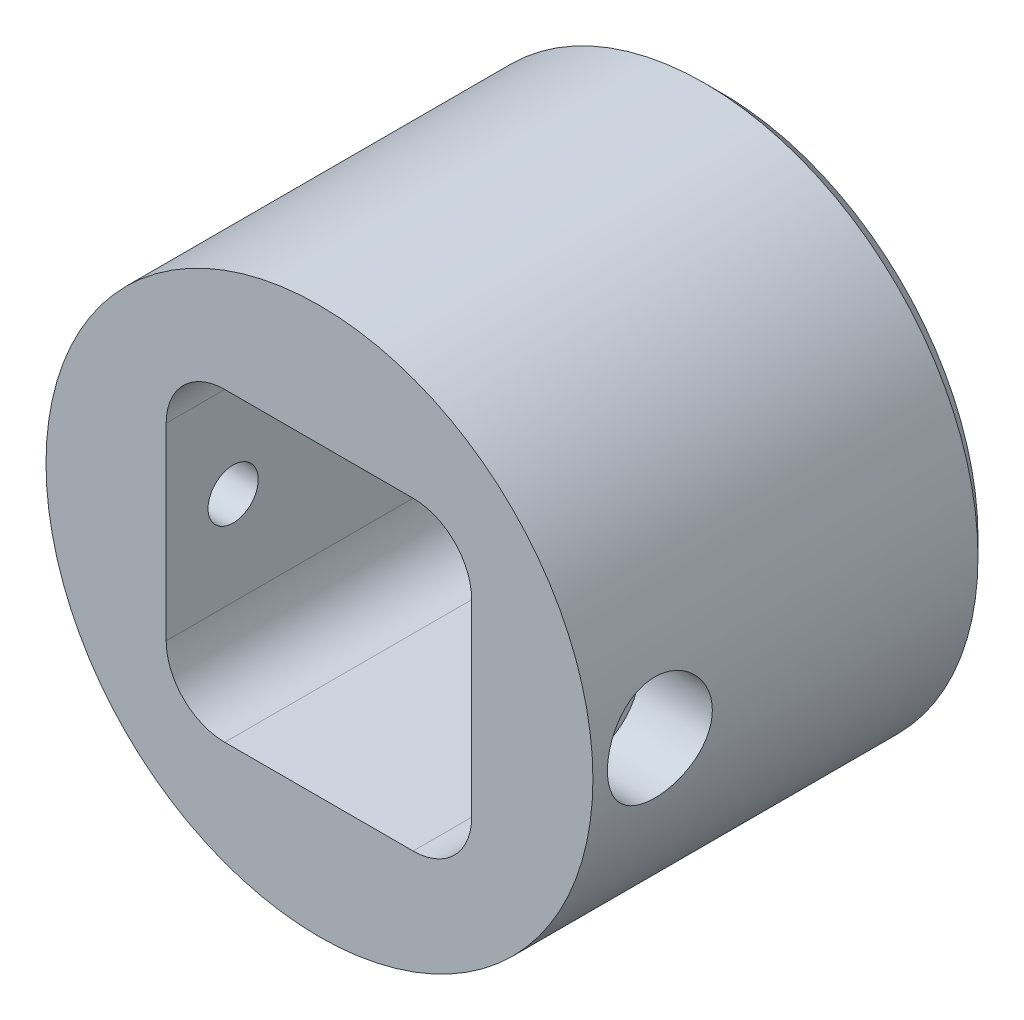
from build123d import *

# Parameters (mm, degrees)
SKETCH1_R               = 12.25
SKETCH1_R_2             = 1.75
BOSS_EXTRUDE1_DEPTH     = 18
CUT_EXTRUDE2_DEPTH      = 25.982493871
CUT_EXTRUDE2_DEPTH_BACK = 25.982493871
SKETCH3_R               = 1.125
CUT_EXTRUDE3_START      = -9
SKETCH4_R               = 2.35
CUT_EXTRUDE3_DEPTH      = 5
CUT_EXTRUDE4_START      = 14
SKETCH4_2_R             = 2.35
CUT_EXTRUDE4_DEPTH      = 5
CUT_EXTRUDE5_DEPTH      = 16
CHAMFER1_SIZE           = 0.75
CHAMFER2_SIZE           = 0.5


with BuildPart() as part:
    # Sketch1 → Boss-Extrude1 (new body)
    with BuildSketch(Plane.XY):
        Circle(SKETCH1_R)
        with Locations((-4.242640687, 4.242640687)):
            Circle(SKETCH1_R_2, mode=Mode.SUBTRACT)
        with Locations((4.242640687, 4.242640687)):
            Circle(SKETCH1_R_2, mode=Mode.SUBTRACT)
        with Locations((4.242640687, -4.242640687)):
            Circle(SKETCH1_R_2, mode=Mode.SUBTRACT)
        with Locations((-4.242640687, -4.242640687)):
            Circle(SKETCH1_R_2, mode=Mode.SUBTRACT)
    extrude(amount=BOSS_EXTRUDE1_DEPTH)

    # Sketch3 → Cut-Extrude2 (cut, two sides: drawn at the far end of the back side and taken through both)
    with BuildSketch(Plane(origin=(0, 0, 0), x_dir=(0, 0, -1), z_dir=(1, 0, 0)).offset(-CUT_EXTRUDE2_DEPTH_BACK)):
        with Locations((-15, 0)):
            Circle(SKETCH3_R)
    extrude(amount=CUT_EXTRUDE2_DEPTH + CUT_EXTRUDE2_DEPTH_BACK, mode=Mode.SUBTRACT)

    # Sketch4 → Cut-Extrude3 (cut)
    with BuildSketch(Plane(origin=(0, 0, 0), x_dir=(0, 0, -1), z_dir=(1, 0, 0)).offset(CUT_EXTRUDE3_START)):
        with Locations((-15, 0)):
            Circle(SKETCH4_R)
    extrude(amount=-CUT_EXTRUDE3_DEPTH, mode=Mode.SUBTRACT)

    # Sketch4<2> → Cut-Extrude4 (cut)
    with BuildSketch(Plane(origin=(0, 0, 0), x_dir=(0, 0, -1), z_dir=(1, 0, 0)).offset(CUT_EXTRUDE4_START)):
        with Locations((-15, 0)):
            Circle(SKETCH4_2_R)
    extrude(amount=-CUT_EXTRUDE4_DEPTH, mode=Mode.SUBTRACT)

    # Sketch2 → Cut-Extrude5 (cut)
    with BuildSketch(Plane.XY.offset(18)):
        with BuildLine():
            Line((4.19425359, 6.867640687), (-4.242640687, 6.867640687))
            ThreePointArc((-4.242640687, 6.867640687), (-6.098795988, 6.098795988), (-6.867640687, 4.242640687))
            Line((-6.867640687, 4.242640687), (-6.867640687, -4.19425359))
            ThreePointArc((-6.867640687, -4.19425359), (-6.098795988, -6.050408891), (-4.242640687, -6.81925359))
            Line((-4.242640687, -6.81925359), (4.194253555, -6.81925359))
            ThreePointArc((4.194253555, -6.81925359), (6.050408878, -6.050408904), (6.81925359, -4.19425359))
            Line((6.81925359, -4.19425359), (6.81925359, 4.242640687))
            ThreePointArc((6.81925359, 4.242640687), (6.050408891, 6.098795988), (4.19425359, 6.867640687))
        make_face()
    extrude(amount=-CUT_EXTRUDE5_DEPTH, mode=Mode.SUBTRACT)

    # Chamfer1
    chamfer1_edges = [part.edges().sort_by_distance(p)[0] for p in [
        (-12.25, 0, 0),
    ]]
    chamfer(chamfer1_edges, length=CHAMFER1_SIZE)

    # Chamfer2
    chamfer2_edges = [part.edges().sort_by_distance(p)[0] for p in [
        (2.492640687, -4.242640687, 0),
        (-5.992640687, -4.242640687, 0),
        (-5.992640687, 4.242640687, 0),
        (2.492640687, 4.242640687, 0),
    ]]
    chamfer(chamfer2_edges, length=CHAMFER2_SIZE)


solid = part.part
